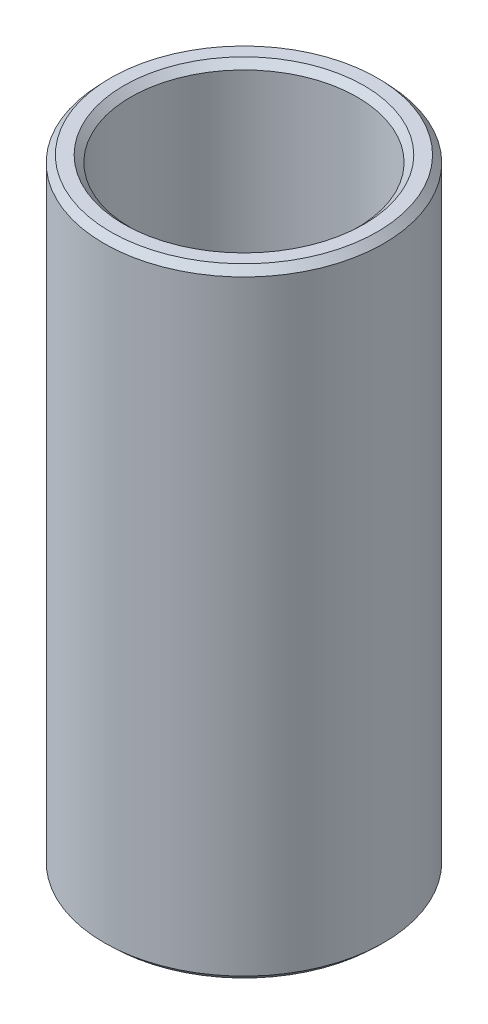
from build123d import *
from OCP.BRepFilletAPI import BRepFilletAPI_MakeChamfer

# Parameters (mm, degrees)
SKETCH1_R           = 42.5
BOSS_EXTRUDE1_DEPTH = 188.040535068
SKETCH2_R           = 34.410946941
CUT_EXTRUDE1_DEPTH  = 198.412620743
CHAMFER1_SIZE       = 2.082141442
CHAMFER1_SIZE2      = 1.973153705


with BuildPart() as part:
    # Sketch1 → Boss-Extrude1 (new body)
    with BuildSketch(Plane(origin=(0, 0, 0), x_dir=(1, 0, 0), z_dir=(0, 1, 0))):
        Circle(SKETCH1_R)
    extrude(amount=BOSS_EXTRUDE1_DEPTH)

    # Sketch2 → Cut-Extrude1 (cut, through all)
    with BuildSketch(Plane(origin=(0, 0, 0), x_dir=(1, 0, 0), z_dir=(0, 1, 0))):
        Circle(SKETCH2_R)
    extrude(amount=CUT_EXTRUDE1_DEPTH, mode=Mode.SUBTRACT)

    # Chamfer1: one chamfer whose edges measure the first distance from different faces: ONE call of the kernel's chamfer builder (chamfer() names one face for all edges)
    chamfer1_edges_1 = [part.edges().sort_by_distance(p)[0] for p in [
        (-34.410946941, 188.040535068, 0),
    ]]
    chamfer1_side_1 = [part.faces().sort_by_distance(p)[0] for p in [
        (-41.297918472, 188.040535068, 0),
    ]]
    chamfer1_edges_2 = [part.edges().sort_by_distance(p)[0] for p in [
        (-34.410946941, 0, 0),
    ]]
    chamfer1_side_2 = [part.faces().sort_by_distance(p)[0] for p in [
        (-34.410946941, 94.020267534, 0),
    ]]
    chamfer1_edges_3 = [part.edges().sort_by_distance(p)[0] for p in [
        (-42.5, 0, 0),
    ]]
    chamfer1_side_3 = [part.faces().sort_by_distance(p)[0] for p in [
        (-41.297918472, 0, 0),
    ]]
    chamfer1_edges_4 = [part.edges().sort_by_distance(p)[0] for p in [
        (-42.5, 188.040535068, 0),
    ]]
    chamfer1_side_4 = [part.faces().sort_by_distance(p)[0] for p in [
        (-42.5, 94.020267534, 0),
    ]]
    chamfer1 = BRepFilletAPI_MakeChamfer(part.part.solid().wrapped)
    for e in chamfer1_edges_1:
        chamfer1.Add(CHAMFER1_SIZE, CHAMFER1_SIZE2, e.wrapped, chamfer1_side_1[0].wrapped)  # the first distance lies on this face
    for e in chamfer1_edges_2:
        chamfer1.Add(CHAMFER1_SIZE, CHAMFER1_SIZE2, e.wrapped, chamfer1_side_2[0].wrapped)  # the first distance lies on this face
    for e in chamfer1_edges_3:
        chamfer1.Add(CHAMFER1_SIZE, CHAMFER1_SIZE2, e.wrapped, chamfer1_side_3[0].wrapped)  # the first distance lies on this face
    for e in chamfer1_edges_4:
        chamfer1.Add(CHAMFER1_SIZE, CHAMFER1_SIZE2, e.wrapped, chamfer1_side_4[0].wrapped)  # the first distance lies on this face
    add(Compound.cast(chamfer1.Shape()), mode=Mode.REPLACE)


solid = part.part
